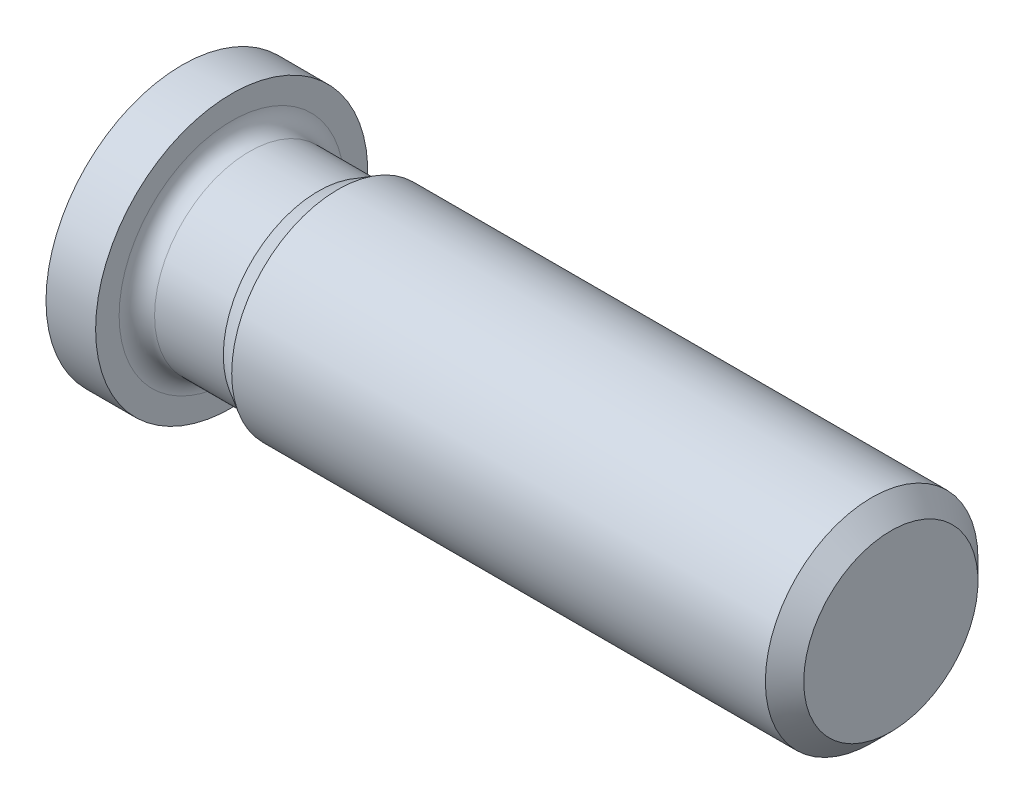
from build123d import *

# Parameters (mm, degrees)
ENDCHAMFER_SIZE = 0.5415


with BuildPart() as part:
    # Sketch1 → Base (revolve)
    with BuildSketch(Plane.XY):
        with BuildLine():
            Line((0, 0), (0, 0.44))
            Line((0, 0.44), (0.83, 0.919200723))
            Line((0.83, 0.919200723), (1.136988374, 3.84))
            Line((1.136988374, 3.84), (2.536988374, 3.84))
            Line((2.536988374, 3.84), (2.536988374, 3.1765))
            ThreePointArc((2.536988374, 3.1765), (2.683434984, 2.822946609), (3.036988374, 2.6765))
            Line((3.036988374, 2.6765), (4.976669938, 2.6765))
            Line((4.976669938, 2.6765), (5.536988374, 3))
            Line((5.536988374, 3), (21.136988374, 3))
            Line((21.136988374, 3), (21.136988374, 0))
            Line((21.136988374, 0), (0, 0))
        make_face()
    revolve(axis=Axis((0, 0, 0), (1, 0, 0)))

    # EndChamfer
    endchamfer_edges = [part.edges().sort_by_distance(p)[0] for p in [
        (21.136988374, -3, 0),
    ]]
    chamfer(endchamfer_edges, length=ENDCHAMFER_SIZE)


solid = part.part
